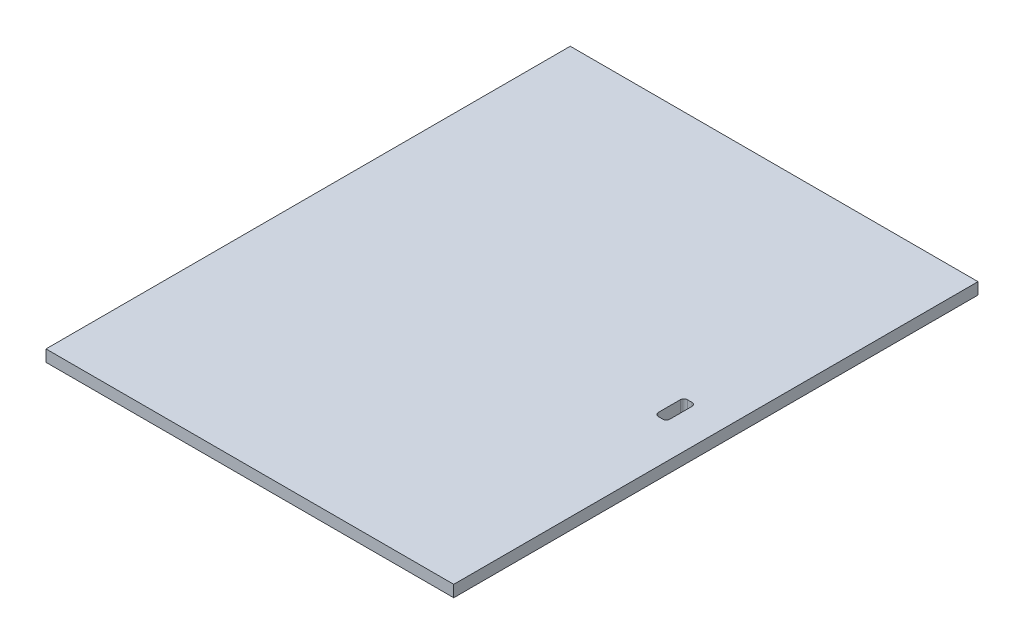
from build123d import *

# Parameters (mm, degrees)
SKETCH_1_W          = 700
SKETCH_1_H          = 900
EXTRUDE_1_DEPTH     = 20
CUT_EXTRUDE_1_DEPTH = 20


with BuildPart() as part:
    # 草图1 → 凸台-拉伸1 (new body)
    with BuildSketch(Plane(origin=(0, 0, 0), x_dir=(1, 0, 0), z_dir=(0, 1, 0))):
        with Locations((350, 450)):
            Rectangle(SKETCH_1_W, SKETCH_1_H)
    extrude(amount=EXTRUDE_1_DEPTH)

    # 草图2 → 切除-拉伸1 (cut)
    with BuildSketch(Plane(origin=(0, 20, 0), x_dir=(1, 0, 0), z_dir=(0, 1, 0))):
        with BuildLine():
            Line((626, 475), (634, 475))
            ThreePointArc((634, 475), (638.242640687, 473.242640687), (640, 469))
            Line((640, 469), (640, 431))
            ThreePointArc((640, 431), (638.242640687, 426.757359313), (634, 425))
            Line((634, 425), (626, 425))
            ThreePointArc((626, 425), (621.757359313, 426.757359313), (620, 431))
            Line((620, 431), (620, 469))
            ThreePointArc((620, 469), (621.757359313, 473.242640687), (626, 475))
        make_face()
    extrude(amount=-CUT_EXTRUDE_1_DEPTH, mode=Mode.SUBTRACT)


solid = part.part
